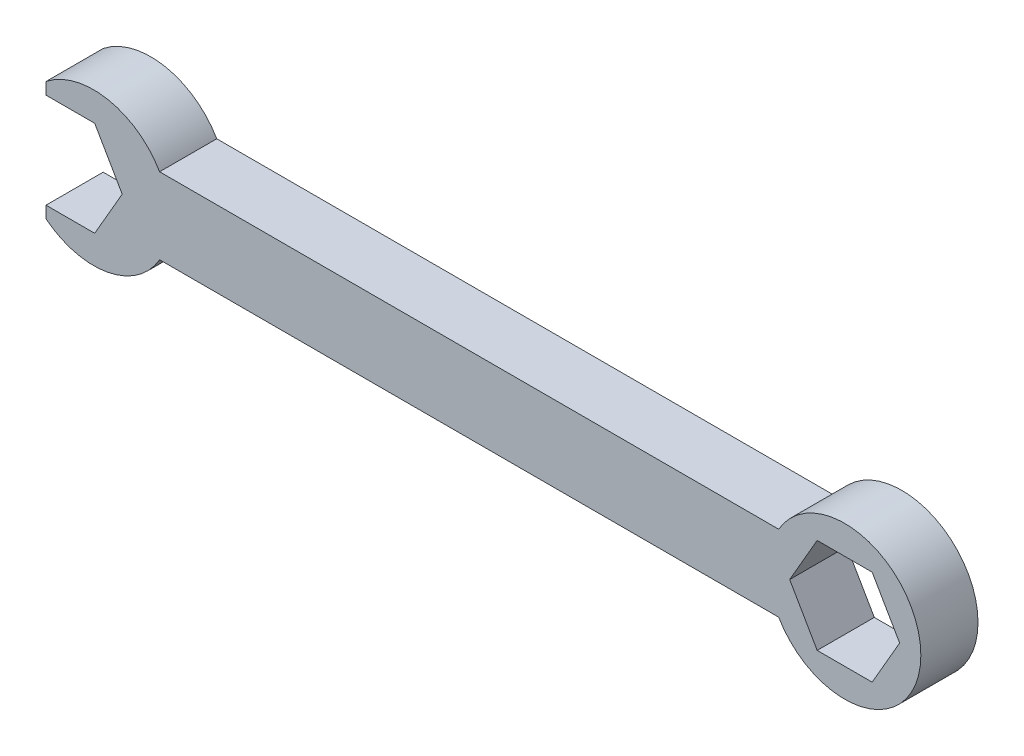
from build123d import *

# Parameters (mm, degrees)
BOSS_EXTRUDE1_DEPTH = 3.81


with BuildPart() as part:
    # Sketch1 → Boss-Extrude1 (new, symmetric)
    with BuildSketch(Plane.XY):
        with BuildLine():
            Line((4.988818102, 5.08), (87.538818102, 5.08))
            ThreePointArc((87.538818102, 5.08), (106.497636205, 0), (87.538818102, -5.08))
            Line((87.538818102, -5.08), (4.988818102, -5.08))
            ThreePointArc((4.988818102, -5.08), (-1.930787936, -9.984696391), (-10.16, -7.931147458))
            Line((-10.16, -7.931147458), (-10.16, -6.35))
            Line((-10.16, -6.35), (-3.666174209, -6.35))
            Line((-3.666174209, -6.35), (0, 0))
            Line((0, 0), (-3.666174209, 6.35))
            Line((-3.666174209, 6.35), (-10.16, 6.35))
            Line((-10.16, 6.35), (-10.16, 7.931147458))
            ThreePointArc((-10.16, 7.931147458), (-1.930787936, 9.984696391), (4.988818102, 5.08))
        make_face()
        Polygon((103.669984624, 0), (100.003810414, 6.35), (92.671461996, 6.35), (89.005287786, 0), (92.671461996, -6.35), (100.003810414, -6.35), align=None, mode=Mode.SUBTRACT)
    extrude(amount=BOSS_EXTRUDE1_DEPTH, both=True)


solid = part.part
